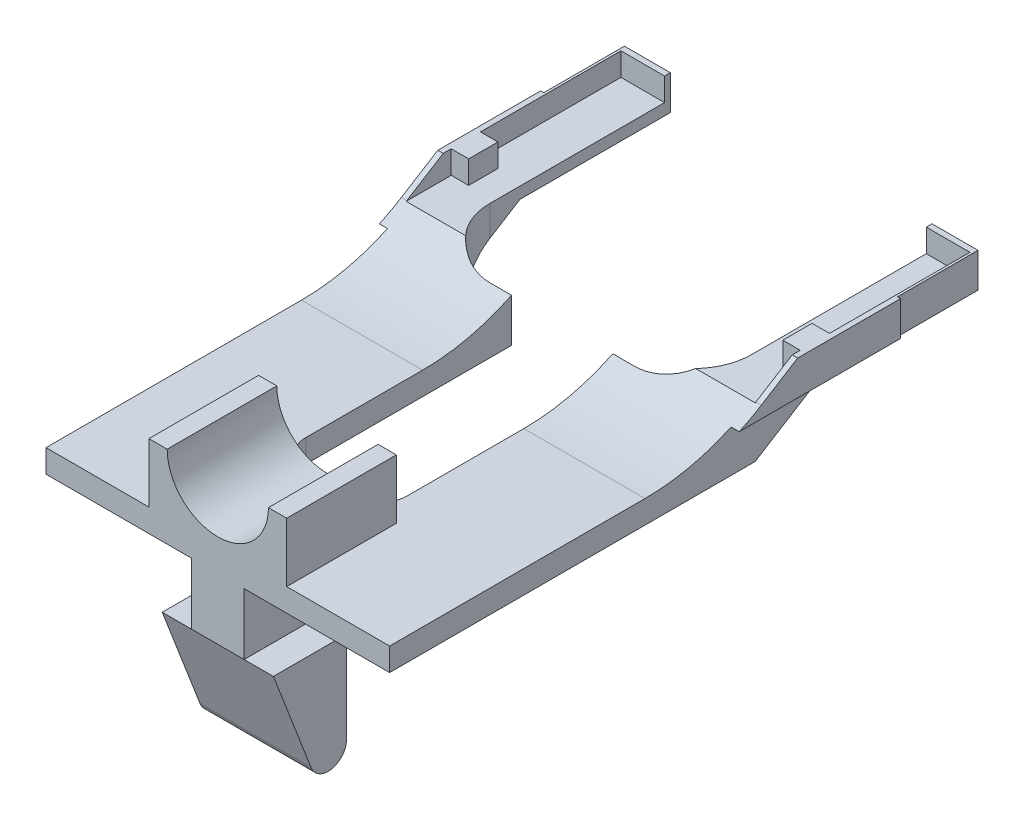
from build123d import *

# Parameters (mm, degrees)
SKETCH2_W               = 11.9687594
SKETCH2_H               = 2.75
BOSS_EXTRUDE1_DEPTH     = 9.525
BOSS_EXTRUDE2_START     = 3.175
SKETCH2_3_W             = 11.9687594
SKETCH2_3_H             = 2.75
SKETCH2_3_W_2           = 4.572
SKETCH2_3_H_2           = 5.334
BOSS_EXTRUDE2_DEPTH     = 6.35
BOSS_EXTRUDE3_DEPTH     = 2
BOSS_EXTRUDE7_DEPTH     = 25.4
SKETCH5_W               = 9.771111266
SKETCH5_H               = 3
CUT_EXTRUDE1_DEPTH      = 78.484078326
SKETCH6_W               = 30.314979468
SKETCH6_H               = 2.000002
SKETCH6_W_2             = 22.73097918
SKETCH6_H_2             = 6.646875
CUT_EXTRUDE2_DEPTH      = 20.258872
CUT_EXTRUDE3_START      = 0.499999
SKETCH6_3_W             = 22.73097918
SKETCH6_3_H             = 2.000002
SKETCH6_3_H_2           = 4.646873
SKETCH6_3_W_2           = 0.271399
SKETCH6_3_H_3           = 3
CUT_EXTRUDE3_DEPTH      = 7.0000114
FILLET2_R               = 17.78
CUT_EXTRUDE4_DEPTH      = 48.132860149
CUT_EXTRUDE4_DEPTH_BACK = 48.132860149
SKETCH7_W               = 8.7937594
SKETCH7_H               = 20.387434944
FILLET3_R               = 2.54
SKETCH8_W               = 1.515000072
SKETCH8_H               = 2.54
BOSS_EXTRUDE8_DEPTH     = 2
FILLET4_R               = 5.08
CUT_EXTRUDE5_DEPTH      = 49.292968639


with BuildPart() as part:
    # Sketch2 → Boss-Extrude1 (new body)
    with BuildSketch(Plane.XY):
        with BuildLine():
            ThreePointArc((-9e-09, 2.75), (-3.109063455, 4.037816251), (-4.3968797, 7.1468797))
            Line((-4.3968797, 7.1468797), (-5.9843797, 7.1468797))
            Line((-5.9843797, 7.1468797), (-5.9843797, 2.75))
            Line((-5.9843797, 2.75), (-9e-09, 2.75))
        make_face()
        with BuildLine():
            Line((5.9843797, 7.1468797), (4.3968797, 7.1468797))
            ThreePointArc((4.3968797, 7.1468797), (3.109063449, 4.037816245), (-9e-09, 2.75))
            Line((-9e-09, 2.75), (5.9843797, 2.75))
            Line((5.9843797, 2.75), (5.9843797, 7.1468797))
        make_face()
        with Locations((0, 1.375)):
            Rectangle(SKETCH2_W, SKETCH2_H)
    extrude(amount=BOSS_EXTRUDE1_DEPTH)

    # Sketch2<3> → Boss-Extrude2 (add)
    with BuildSketch(Plane.XY.offset(BOSS_EXTRUDE2_START)):
        with Locations((0, 1.375)):
            Rectangle(SKETCH2_3_W, SKETCH2_3_H)
        with BuildLine():
            ThreePointArc((-9e-09, 2.75), (-3.109063455, 4.037816251), (-4.3968797, 7.1468797))
            Line((-4.3968797, 7.1468797), (-5.9843797, 7.1468797))
            Line((-5.9843797, 7.1468797), (-5.9843797, 2.75))
            Line((-5.9843797, 2.75), (-9e-09, 2.75))
        make_face()
        with BuildLine():
            Line((5.9843797, 7.1468797), (4.3968797, 7.1468797))
            ThreePointArc((4.3968797, 7.1468797), (3.109063449, 4.037816245), (-9e-09, 2.75))
            Line((-9e-09, 2.75), (5.9843797, 2.75))
            Line((5.9843797, 2.75), (5.9843797, 7.1468797))
        make_face()
        with Locations((0, -2.667)):
            Rectangle(SKETCH2_3_W_2, SKETCH2_3_H_2)
        Polygon((2.286, -5.334), (-2.286, -5.334), (-4.826, -5.334), (-4.826, -14.859), (4.826, -14.859), (4.826, -5.334), align=None)
    extrude(amount=BOSS_EXTRUDE2_DEPTH)

    # Sketch3 → Boss-Extrude3 (add)
    with BuildSketch(Plane.XZ):
        Polygon((14.9225, 9.525), (-14.9225, 9.525), (-14.9225, -22.225), (-10.85748959, -22.225), (10.85748959, -22.225), (14.9225, -22.225), align=None)
    extrude(amount=-BOSS_EXTRUDE3_DEPTH)

    # Sketch4<6> → Boss-Extrude7 (add, symmetric)
    with BuildSketch(Plane(origin=(0, 0, 0), x_dir=(0, 0, -1), z_dir=(1, 0, 0))):
        Polygon((28.087296632, 3.646875), (41.146305566, 3.646875), (41.146305566, 6.646875), (25.209889757, 6.646875), (17.740108187, 2), (22.225, 0), align=None)
    extrude(amount=BOSS_EXTRUDE7_DEPTH, both=True)

    # Sketch5 → Cut-Extrude1 (cut, through all)
    with BuildSketch(Plane(origin=(0, 37.971305566, -41.146305566), x_dir=(1, 0, 0), z_dir=(0, 0, 1))):
        Polygon((25.4, -37.971305566), (25.4, -34.324430566), (15.628888734, -34.324430566), (14.9225, -34.324430566), (14.9225, -37.971305566), align=None)
        with Locations((20.514444367, -32.824430566)):
            Rectangle(SKETCH5_W, SKETCH5_H)
        Polygon((-25.4, -34.324430566), (-25.4, -37.971305566), (-14.9225, -37.971305566), (-14.9225, -34.324430566), (-15.628888734, -34.324430566), align=None)
        with Locations((-20.514444367, -32.824430566)):
            Rectangle(SKETCH5_W, SKETCH5_H)
    extrude(amount=CUT_EXTRUDE1_DEPTH, mode=Mode.SUBTRACT)

    # Sketch6 → Cut-Extrude2 (cut)
    with BuildSketch(Plane(origin=(0, 0, -40.646306566), x_dir=(-1, 0, 0), z_dir=(0, 0, -1))):
        with Locations((0, 5.646874)):
            Rectangle(SKETCH6_W, SKETCH6_H)
        with Locations((0, 3.3234375)):
            Rectangle(SKETCH6_W_2, SKETCH6_H_2)
    extrude(amount=-CUT_EXTRUDE2_DEPTH, mode=Mode.SUBTRACT)

    # Sketch6<3> → Cut-Extrude3 (cut)
    with BuildSketch(Plane(origin=(0, 0, -40.646306566), x_dir=(-1, 0, 0), z_dir=(0, 0, -1)).offset(CUT_EXTRUDE3_START)):
        with Locations((0, 5.646874)):
            Rectangle(SKETCH6_3_W, SKETCH6_3_H)
        with Locations((0, 2.3234365)):
            Rectangle(SKETCH6_3_W, SKETCH6_3_H_2)
        with Locations((-15.493189234, 5.146875)):
            Rectangle(SKETCH6_3_W_2, SKETCH6_3_H_3)
        with Locations((15.493189234, 5.146875)):
            Rectangle(SKETCH6_3_W_2, SKETCH6_3_H_3)
    extrude(amount=-CUT_EXTRUDE3_DEPTH, mode=Mode.SUBTRACT)

    # Fillet2
    # the kernel refuses this fillet: 17.78 mm, written as the material it adds along each edge
    with BuildSketch(Plane(origin=(27.620205217, 2, -17.740108187), x_dir=(0, 0.5282208325858079, -0.8491070321357349), z_dir=(-1, 0, 0))) as fillet2_piece_1_section:
        with BuildLine():
            CenterArc((FILLET2_R * 0.285662659546, -FILLET2_R), FILLET2_R, 90, 31.885322289)
            Line((-FILLET2_R * 0.242558173039, -FILLET2_R * 0.150892967864), (0, 0))
            Line((0, 0), (FILLET2_R * 0.285662659546, 0))
        make_face()
    fillet2_piece_1 = extrude(amount=55.240410434, mode=Mode.PRIVATE)
    fillet2_piece_1 = split(fillet2_piece_1, bisect_by=Plane(origin=(15.393189234, 3.646875, -22.00929754), z_dir=(0, 1, 0)), keep=Keep.TOP, mode=Mode.PRIVATE)
    fillet2_piece_1 = split(fillet2_piece_1, bisect_by=Plane(origin=(15.628888734, 4.655865618, -22.00929754), z_dir=(-1, 0, 0)), keep=Keep.TOP, mode=Mode.PRIVATE)
    fillet2_piece_1 = split(fillet2_piece_1, bisect_by=Plane(origin=(15.157489734, 4.655865618, -22.00929754), z_dir=(1, 0, 0)), keep=Keep.TOP, mode=Mode.PRIVATE)
    add(fillet2_piece_1)
    with BuildSketch(Plane(origin=(27.620205217, 2, -17.740108187), x_dir=(0, 0.5282208325858079, -0.8491070321357349), z_dir=(-1, 0, 0))) as fillet2_piece_2_section:
        with BuildLine():
            CenterArc((FILLET2_R * 0.285662659546, -FILLET2_R), FILLET2_R, 90, 31.885322289)
            Line((-FILLET2_R * 0.242558173039, -FILLET2_R * 0.150892967864), (0, 0))
            Line((0, 0), (FILLET2_R * 0.285662659546, 0))
        make_face()
    fillet2_piece_2 = extrude(amount=55.240410434, mode=Mode.PRIVATE)
    fillet2_piece_2 = split(fillet2_piece_2, bisect_by=Plane(origin=(15.039994889, 3.646875, -20.807533434), z_dir=(0, 1, 0)), keep=Keep.TOP, mode=Mode.PRIVATE)
    fillet2_piece_2 = split(fillet2_piece_2, bisect_by=Plane(origin=(15.157489734, 3.944287392, -20.807533434), z_dir=(-1, 0, 0)), keep=Keep.TOP, mode=Mode.PRIVATE)
    fillet2_piece_2 = split(fillet2_piece_2, bisect_by=Plane(origin=(15.039994889, 4.646873, -20.807533434), z_dir=(0, -1, 0)), keep=Keep.TOP, mode=Mode.PRIVATE)
    fillet2_piece_2 = split(fillet2_piece_2, bisect_by=Plane(origin=(11.36548959, 3.944287392, -20.807533434), z_dir=(1, 0, 0)), keep=Keep.TOP, mode=Mode.PRIVATE)
    add(fillet2_piece_2)
    with BuildSketch(Plane(origin=(14.9225, 2, -17.740108187), x_dir=(0, 0.528220832585808, -0.8491070321357348), z_dir=(-1, 0, 0))) as fillet2_piece_3_section:
        with BuildLine():
            CenterArc((FILLET2_R * 0.285662659546, -FILLET2_R), FILLET2_R, 90, 31.885322289)
            Line((-FILLET2_R * 0.242558173039, -FILLET2_R * 0.150892967864), (0, 0))
            Line((0, 0), (FILLET2_R * 0.285662659546, 0))
        make_face()
    fillet2_piece_3 = extrude(amount=29.845, mode=Mode.PRIVATE)
    fillet2_piece_3 = split(fillet2_piece_3, bisect_by=Plane(origin=(13.143994801, 2.494402422, -20.387434566), z_dir=(0, 0, 1)), keep=Keep.TOP, mode=Mode.PRIVATE)
    add(fillet2_piece_3)
    with BuildSketch(Plane(origin=(27.620205217, 2, -17.740108187), x_dir=(0, 0.5282208325858079, -0.8491070321357349), z_dir=(-1, 0, 0))) as fillet2_piece_4_section:
        with BuildLine():
            CenterArc((FILLET2_R * 0.285662659546, -FILLET2_R), FILLET2_R, 90, 31.885322289)
            Line((-FILLET2_R * 0.242558173039, -FILLET2_R * 0.150892967864), (0, 0))
            Line((0, 0), (FILLET2_R * 0.285662659546, 0))
        make_face()
    fillet2_piece_4 = extrude(amount=55.240410434, mode=Mode.PRIVATE)
    fillet2_piece_4 = split(fillet2_piece_4, bisect_by=Plane(origin=(-15.628888734, 3.94428727, -20.807533615), z_dir=(1, 0, 0)), keep=Keep.TOP, mode=Mode.PRIVATE)
    fillet2_piece_4 = split(fillet2_piece_4, bisect_by=Plane(origin=(-13.143995303, 3.646875, -20.807533615), z_dir=(0, 1, 0)), keep=Keep.TOP, mode=Mode.PRIVATE)
    fillet2_piece_4 = split(fillet2_piece_4, bisect_by=Plane(origin=(-13.143995303, 4.646873, -20.807533615), z_dir=(0, -1, 0)), keep=Keep.TOP, mode=Mode.PRIVATE)
    fillet2_piece_4 = split(fillet2_piece_4, bisect_by=Plane(origin=(-11.36548959, 3.94428727, -20.807533615), z_dir=(-1, 0, 0)), keep=Keep.TOP, mode=Mode.PRIVATE)
    add(fillet2_piece_4)
    with BuildSketch(Plane(origin=(27.620205217, 2, -17.740108187), x_dir=(0, 0.5282208325858079, -0.8491070321357349), z_dir=(-1, 0, 0))) as fillet2_piece_5_section:
        with BuildLine():
            CenterArc((FILLET2_R * 0.285662659546, -FILLET2_R), FILLET2_R, 90, 31.885322289)
            Line((-FILLET2_R * 0.242558173039, -FILLET2_R * 0.150892967864), (0, 0))
            Line((0, 0), (FILLET2_R * 0.285662659546, 0))
        make_face()
    fillet2_piece_5 = extrude(amount=55.240410434, mode=Mode.PRIVATE)
    fillet2_piece_5 = split(fillet2_piece_5, bisect_by=Plane(origin=(-15.628888734, 4.655865618, -22.00929754), z_dir=(1, 0, 0)), keep=Keep.TOP, mode=Mode.PRIVATE)
    fillet2_piece_5 = split(fillet2_piece_5, bisect_by=Plane(origin=(-15.393189234, 4.655865618, -20.387434566), z_dir=(0, 0, -1)), keep=Keep.TOP, mode=Mode.PRIVATE)
    fillet2_piece_5 = split(fillet2_piece_5, bisect_by=Plane(origin=(-15.157489734, 4.655865618, -22.00929754), z_dir=(-1, 0, 0)), keep=Keep.TOP, mode=Mode.PRIVATE)
    add(fillet2_piece_5)

    # Sketch7 → Cut-Extrude4 (cut, two sides: drawn at the far end of the back side and taken through both)
    with BuildSketch(Plane(origin=(0, 2, 0), x_dir=(1, 0, 0), z_dir=(0, 1, 0)).offset(-CUT_EXTRUDE4_DEPTH_BACK)):
        with Locations((0, 10.193717472)):
            Rectangle(SKETCH7_W, SKETCH7_H)
    extrude(amount=CUT_EXTRUDE4_DEPTH + CUT_EXTRUDE4_DEPTH_BACK, mode=Mode.SUBTRACT)

    # Fillet3
    fillet3_edges = [part.edges().sort_by_distance(p)[0] for p in [
        (4.3968797, 1, 0),
        (-4.3968797, 1, 0),
    ]]
    fillet(fillet3_edges, radius=FILLET3_R)

    # Sketch8 → Boss-Extrude8 (add)
    with BuildSketch(Plane(origin=(0, 4.646873, 0), x_dir=(1, 0, 0), z_dir=(0, 1, 0))):
        with Locations((-14.399989698, 27.176306566)):
            Rectangle(SKETCH8_W, SKETCH8_H)
        with Locations((14.399989698, 27.176306566)):
            Rectangle(SKETCH8_W, SKETCH8_H)
    extrude(amount=BOSS_EXTRUDE8_DEPTH)

    # Fillet4
    fillet4_edges = [part.edges().sort_by_distance(p)[0] for p in [
        (11.36548959, 1.883268266, -20.387434566),
        (-11.36548959, 1.883268266, -20.387434566),
    ]]
    fillet(fillet4_edges, radius=FILLET4_R)

    # Sketch10 → Cut-Extrude5 (cut, through all)
    with BuildSketch(Plane(origin=(4.826, 0, 0), x_dir=(0, 0, -1), z_dir=(1, 0, 0))):
        with BuildLine():
            Line((-6.243675471, -13.842705282), (-9.525, -5.334))
            Line((-9.525, -5.334), (-9.525, -14.859))
            Line((-9.525, -14.859), (-4.7625, -14.859))
            ThreePointArc((-4.7625, -14.859), (-5.660655851, -14.580496684), (-6.243675471, -13.842705282))
        make_face()
        with BuildLine():
            ThreePointArc((-3.175, -13.2715), (-3.639967985, -14.394032015), (-4.7625, -14.859))
            Line((-4.7625, -14.859), (-3.175, -14.859))
            Line((-3.175, -14.859), (-3.175, -13.2715))
        make_face()
    extrude(amount=-CUT_EXTRUDE5_DEPTH, mode=Mode.SUBTRACT)


solid = part.part
